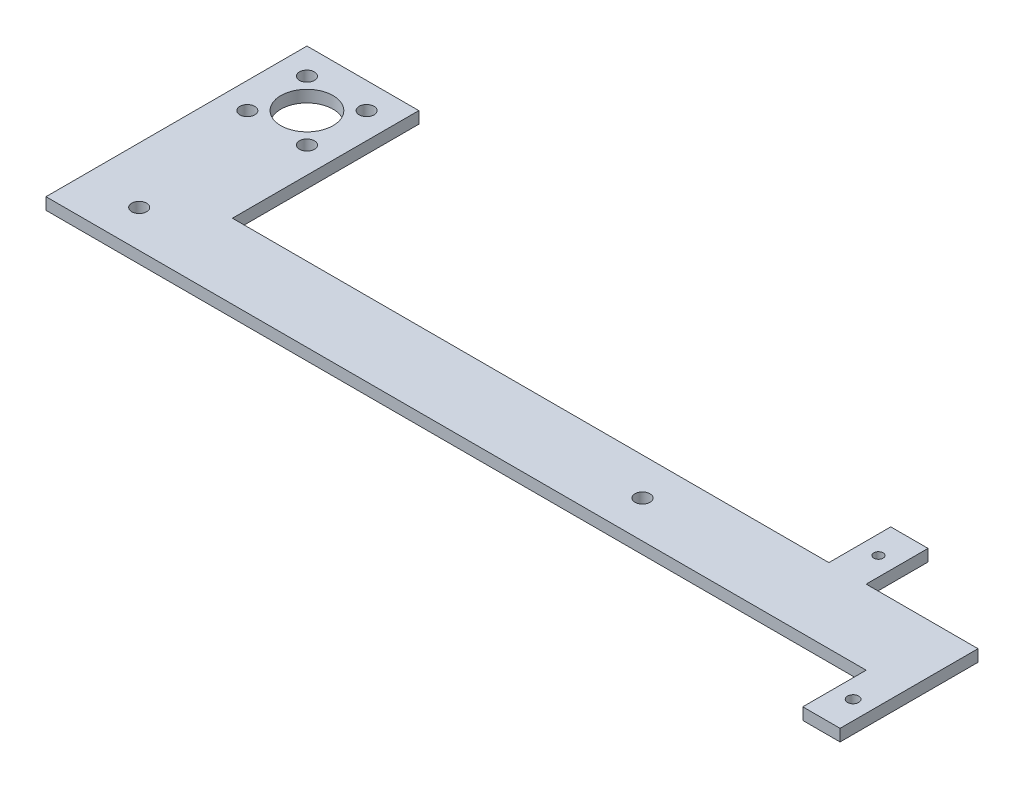
from build123d import *

# Parameters (mm, degrees)
SKETCH1_R           = 1.5
SKETCH1_R_2         = 2
SKETCH1_R_3         = 1.25
BOSS_EXTRUDE1_DEPTH = 3.175


with BuildPart() as part:
    # Sketch1 → Boss-Extrude1 (new body)
    with BuildSketch(Plane(origin=(0, 0, 0), x_dir=(1, 0, 0), z_dir=(0, 1, 0))):
        Polygon((220, -17), (225, -17), (230, -17), (230, 10), (230, 20), (200, 20), (200, 36.6), (195, 36.6), (190, 36.6), (190, 20), (30, 20), (30, 70), (15, 70), (0, 70), (0, 0), (220, 0), align=None)
        with Locations((225, -8.5)):
            Circle(SKETCH1_R, mode=Mode.SUBTRACT)
        with Locations((15, 10)):
            Circle(SKETCH1_R_2, mode=Mode.SUBTRACT)
        with BuildLine():
            ThreePointArc((148, 10), (150, 12), (152, 10))
            ThreePointArc((152, 10), (150, 8), (148, 10))
        make_face(mode=Mode.SUBTRACT)
        with Locations((7, 47)):
            Circle(SKETCH1_R_2, mode=Mode.SUBTRACT)
        with Locations((23, 47)):
            Circle(SKETCH1_R_2, mode=Mode.SUBTRACT)
        with BuildLine():
            ThreePointArc((10.050252532, 59.949747468), (12.321215973, 61.467156728), (15, 62))
            ThreePointArc((15, 62), (17.678784027, 48.532843272), (10.050252532, 59.949747468))
        make_face(mode=Mode.SUBTRACT)
        with Locations((7, 63)):
            Circle(SKETCH1_R_2, mode=Mode.SUBTRACT)
        with Locations((23, 63)):
            Circle(SKETCH1_R_2, mode=Mode.SUBTRACT)
        with Locations((195, 28.3)):
            Circle(SKETCH1_R_3, mode=Mode.SUBTRACT)
    extrude(amount=BOSS_EXTRUDE1_DEPTH)


solid = part.part
